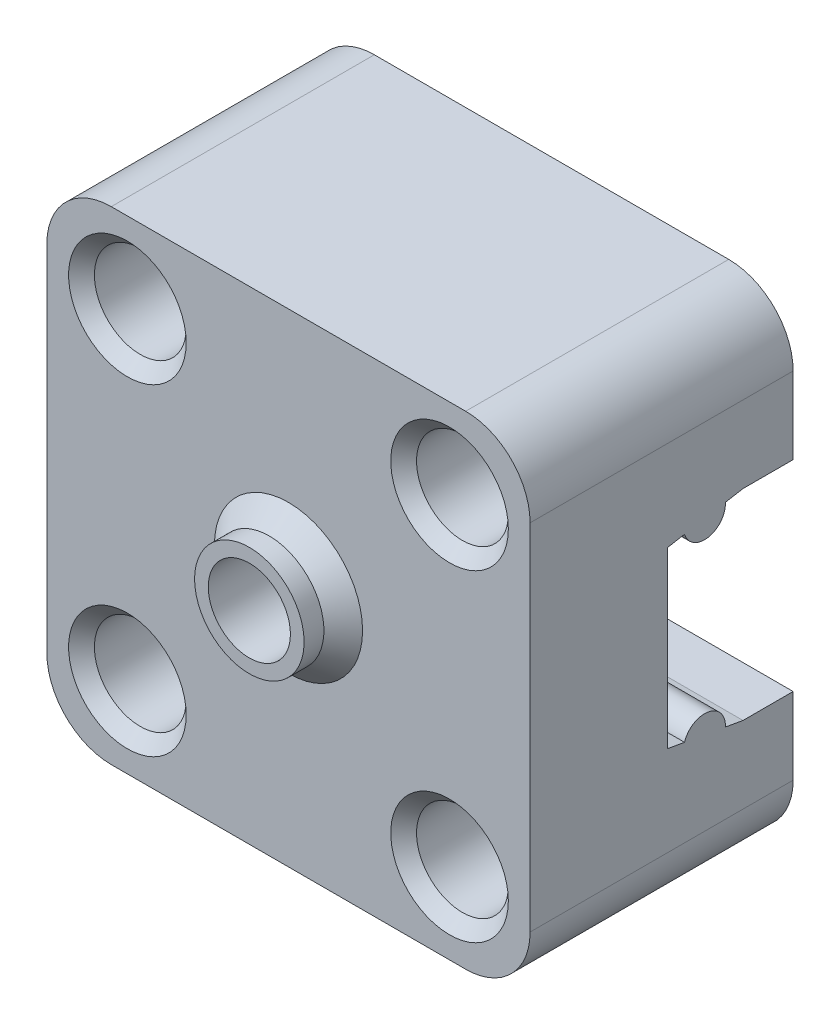
from build123d import *

# Parameters (mm, degrees)
SKETCH1_W                  = 30
SKETCH1_H                  = 30
SKETCH1_R                  = 1.6
SKETCH1_W_2                = 70
SKETCH1_H_2                = 12
BOSS_EXTRUDE1_DEPTH        = 6
SKETCH1_3_W                = 30
SKETCH1_3_H                = 30
SKETCH1_3_R                = 1.6
BOSS_EXTRUDE2_DEPTH        = 22.33
CUT_EXTRUDE1_DEPTH         = 78.612040947
SKETCH3_R                  = 2.55
CUT_EXTRUDE2_DEPTH         = 8
CUT_EXTRUDE3_DEPTH         = 4.5
SKETCH6_R                  = 5
CUT_EXTRUDE5_DEPTH         = 8.6
SKETCH7_R                  = 1.6
CUT_EXTRUDE6_DEPTH         = 101.740403513
SKETCH8_R                  = 2.85
CUT_EXTRUDE7_DEPTH         = 11
BOSS_EXTRUDE3_START        = 2.43
SKETCH9_R                  = 3.4
SKETCH9_R_2                = 2.55
BOSS_EXTRUDE3_DEPTH        = 2.43
CHAMFER1_SIZE              = 1.2
FILLET3_R                  = 4
CHAMFER2_SIZE              = 0.8
CUT_EXTRUDE8_DEPTH         = 3
CHAMFER3_SIZE              = 0.8
LPATTERN1_COUNT            = 3
LPATTERN1_PITCH            = 25
CHAMFER3_OF_LPATTERN1_SIZE = 0.8
SKETCH12_W                 = 103.210606925
SKETCH12_H                 = 33.832940417
CUT_EXTRUDE9_DEPTH         = 6


with BuildPart() as part:
    # Sketch1 → Boss-Extrude1 (new body)
    # profile 1 of 2: a face of its own
    with BuildSketch(Plane.XY):
        with Locations((10, 10)):
            Rectangle(SKETCH1_W, SKETCH1_H)
        with Locations((20, 0)):
            Circle(SKETCH1_R, mode=Mode.SUBTRACT)
        with Locations((20, 20)):
            Circle(SKETCH1_R, mode=Mode.SUBTRACT)
        with Locations((0, 20)):
            Circle(SKETCH1_R, mode=Mode.SUBTRACT)
        Circle(SKETCH1_R, mode=Mode.SUBTRACT)
    # profile 2 of 2: a face of its own
    with BuildSketch(Plane.XY):
        with Locations((60, 10)):
            Rectangle(SKETCH1_W_2, SKETCH1_H_2)
    extrude(amount=BOSS_EXTRUDE1_DEPTH)

    # Sketch1<3> → Boss-Extrude2 (add)
    with BuildSketch(Plane.XY):
        with Locations((10, 10)):
            Rectangle(SKETCH1_3_W, SKETCH1_3_H)
        with Locations((20, 0)):
            Circle(SKETCH1_3_R, mode=Mode.SUBTRACT)
        with Locations((20, 20)):
            Circle(SKETCH1_3_R, mode=Mode.SUBTRACT)
        with Locations((0, 20)):
            Circle(SKETCH1_3_R, mode=Mode.SUBTRACT)
        Circle(SKETCH1_3_R, mode=Mode.SUBTRACT)
    extrude(amount=BOSS_EXTRUDE2_DEPTH)

    # Sketch2 → Cut-Extrude1 (cut, through all)
    with BuildSketch(Plane(origin=(25, 0, 0), x_dir=(0, 0, -1), z_dir=(1, 0, 0))):
        with BuildLine():
            Line((-6.515476918, 16.231667643), (-9.112158418, 16.231667643))
            Line((-9.112158418, 16.231667643), (-10.20449761, 16.039058771))
            ThreePointArc((-10.20449761, 16.039058771), (-11.275650893, 14.693383456), (-12.742453793, 15.59154862))
            Line((-12.742453793, 15.59154862), (-13.786185118, 15.407510627))
            Line((-13.786185118, 15.407510627), (-13.786185118, 4.591753459))
            Line((-13.786185118, 4.591753459), (-12.742453793, 4.407715465))
            ThreePointArc((-12.742453793, 4.407715465), (-11.275650893, 5.305880629), (-10.20449761, 3.960205314))
            Line((-10.20449761, 3.960205314), (-9.112158418, 3.767596443))
            Line((-9.112158418, 3.767596443), (-6.515476918, 3.767596443))
            Line((-6.515476918, 3.767596443), (-5.902540869, 3.767596443))
            Line((-5.902540869, 3.767596443), (-5.902540869, 16.231667643))
            Line((-5.902540869, 16.231667643), (-6.515476918, 16.231667643))
        make_face()
    extrude(amount=-CUT_EXTRUDE1_DEPTH, mode=Mode.SUBTRACT)

    # Sketch3 → Cut-Extrude2 (cut)
    with BuildSketch(Plane.XY.offset(22.33)):
        with Locations((10, 10)):
            Circle(SKETCH3_R)
    extrude(amount=-CUT_EXTRUDE2_DEPTH, mode=Mode.SUBTRACT)

    # Sketch5 → Cut-Extrude3 (cut)
    with BuildSketch(Plane(origin=(0, 0, 13.786185118), x_dir=(-1, 0, 0), z_dir=(0, 0, -1))):
        Polygon((-5.32346282, 10), (-7.66173141, 14.05), (-12.33826859, 14.05), (-14.67653718, 10), (-12.33826859, 5.95), (-7.66173141, 5.95), align=None)
    extrude(amount=-CUT_EXTRUDE3_DEPTH, mode=Mode.SUBTRACT)

    # Sketch6 → Cut-Extrude5 (cut)
    with BuildSketch(Plane(origin=(0, 0, 0), x_dir=(-1, 0, 0), z_dir=(0, 0, -1))):
        with Locations((-10, 10)):
            Circle(SKETCH6_R)
    extrude(amount=-CUT_EXTRUDE5_DEPTH, mode=Mode.SUBTRACT)

    # Sketch7 → Cut-Extrude6 (cut, through all)
    with BuildSketch(Plane(origin=(0, 0, 0), x_dir=(-1, 0, 0), z_dir=(0, 0, -1))):
        with BuildLine():
            ThreePointArc((-90.1, 10), (-88.5, 8.4), (-86.9, 10))
            Line((-86.9, 10), (-90.1, 10))
        make_face()
        with BuildLine():
            Line((-90.1, 10), (-86.9, 10))
            ThreePointArc((-86.9, 10), (-88.5, 11.6), (-90.1, 10))
        make_face()
        with Locations((-63.5, 10)):
            Circle(SKETCH7_R)
        with Locations((-38.5, 10)):
            Circle(SKETCH7_R)
    extrude(amount=-CUT_EXTRUDE6_DEPTH, mode=Mode.SUBTRACT)

    # Sketch8 → Cut-Extrude7 (cut)
    with BuildSketch(Plane.XY.offset(22.33)):
        with Locations((20, 20)):
            Circle(SKETCH8_R)
        with Locations((20, 0)):
            Circle(SKETCH8_R)
        Circle(SKETCH8_R)
        with Locations((0, 20)):
            Circle(SKETCH8_R)
    extrude(amount=-CUT_EXTRUDE7_DEPTH, mode=Mode.SUBTRACT)

    # Sketch9 → Boss-Extrude3 (add)
    with BuildSketch(Plane.XY.offset(22.33).offset(BOSS_EXTRUDE3_START)):
        with Locations(Location((10, 10, 0), (0, 0, 180))):
            Circle(SKETCH9_R)
        with Locations((10, 10)):
            Circle(SKETCH9_R_2, mode=Mode.SUBTRACT)
    extrude(amount=-BOSS_EXTRUDE3_DEPTH)

    # Chamfer1
    chamfer1_edges = [part.edges().sort_by_distance(p)[0] for p in [
        (13.4, 10, 22.33),
    ]]
    chamfer(chamfer1_edges, length=CHAMFER1_SIZE)

    # Fillet3
    # the kernel refuses this fillet: 4 mm, written as the material it adds along each edge
    with BuildSketch(Plane(origin=(25, 4, 0), x_dir=(0, -1, 0), z_dir=(0, 0, 1))) as fillet3_piece_1:
        with BuildLine():
            CenterArc((FILLET3_R, FILLET3_R), FILLET3_R, 180, 90)
            Line((0, FILLET3_R), (0, 0))
            Line((0, 0), (FILLET3_R, 0))
        make_face()
    extrude(amount=5.902540869)
    with BuildSketch(Plane(origin=(25, 16, 0), x_dir=(0, 1, 0), z_dir=(0, 0, 1))) as fillet3_piece_2:
        with BuildLine():
            CenterArc((FILLET3_R, -FILLET3_R), FILLET3_R, 90, 90)
            Line((0, -FILLET3_R), (0, 0))
            Line((0, 0), (FILLET3_R, 0))
        make_face()
    extrude(amount=5.902540869)
    # the kernel refuses this fillet: 4 mm, written as the material it takes off along each edge
    with BuildSketch(Plane(origin=(-5, -5, 32.33), x_dir=(1, 0, 0), z_dir=(0, 0, -1)), Plane(origin=(-5, 25, 32.33), x_dir=(0, -1, 0), z_dir=(0, 0, -1)), Plane(origin=(25, 25, -10), x_dir=(0, -1, 0), z_dir=(0, 0, 1)), Plane(origin=(25, -5, -10), x_dir=(-1, 0, 0), z_dir=(0, 0, 1))) as fillet3_2_piece_1:
        with BuildLine():
            CenterArc((FILLET3_R, -FILLET3_R), FILLET3_R, 90, 90)
            Line((0, -FILLET3_R), (0, 0))
            Line((0, 0), (FILLET3_R, 0))
        make_face()
    extrude(amount=42.33, mode=Mode.SUBTRACT)
    with BuildSketch(Plane(origin=(95, 16, -10), x_dir=(-1, 0, 0), z_dir=(0, 0, 1))) as fillet3_2_piece_2:
        with BuildLine():
            CenterArc((FILLET3_R, FILLET3_R), FILLET3_R, 180, 90)
            Line((0, FILLET3_R), (0, 0))
            Line((0, 0), (FILLET3_R, 0))
        make_face()
    extrude(amount=26, mode=Mode.SUBTRACT)
    with BuildSketch(Plane(origin=(95, 4, -10), x_dir=(-1, 0, 0), z_dir=(0, 0, 1))) as fillet3_2_piece_3:
        with BuildLine():
            CenterArc((FILLET3_R, -FILLET3_R), FILLET3_R, 90, 90)
            Line((0, -FILLET3_R), (0, 0))
            Line((0, 0), (FILLET3_R, 0))
        make_face()
    extrude(amount=26, mode=Mode.SUBTRACT)

    # Chamfer2
    chamfer2_edges = [part.edges().sort_by_distance(p)[0] for p in [
        (-2.85, 20, 22.33),
        (-2.85, 0, 22.33),
        (17.15, 0, 22.33),
        (17.15, 20, 22.33),
    ]]
    chamfer(chamfer2_edges, length=CHAMFER2_SIZE)

    # Sketch10 → Cut-Extrude8 (cut)
    with BuildSketch(Plane(origin=(0, 0, 0), x_dir=(-1, 0, 0), z_dir=(0, 0, -1))):
        Polygon((-85.266838493, 10), (-86.883419246, 12.8), (-90.116580754, 12.8), (-91.733161507, 10), (-90.116580754, 7.2), (-86.883419246, 7.2), align=None)
    cut_extrude8 = extrude(amount=-CUT_EXTRUDE8_DEPTH, mode=Mode.SUBTRACT)

    # Chamfer3
    chamfer3_edges = [part.edges().sort_by_distance(p)[0] for p in [
        (86.075128869, 8.6, 0),
        (86.075128869, 11.4, 0),
        (88.5, 12.8, 0),
        (90.924871131, 11.4, 0),
        (90.924871131, 8.6, 0),
        (88.5, 7.2, 0),
    ]]
    chamfer(chamfer3_edges, length=CHAMFER3_SIZE)

    # LPattern1: Cut-Extrude8 ×3
    with Locations(*[(-i * LPATTERN1_PITCH, 0, 0) for i in range(1, LPATTERN1_COUNT)]):
        add(cut_extrude8, mode=Mode.SUBTRACT)

    # Chamfer3 of LPattern1
    chamfer3_of_lpattern1_edges = [part.edges().sort_by_distance(p)[0] for p in [
        (61.075128869, 8.6, 0),
        (61.075128869, 11.4, 0),
        (63.5, 12.8, 0),
        (65.924871131, 11.4, 0),
        (65.924871131, 8.6, 0),
        (63.5, 7.2, 0),
        (36.075128869, 8.6, 0),
        (36.075128869, 11.4, 0),
        (38.5, 12.8, 0),
        (40.924871131, 11.4, 0),
        (40.924871131, 8.6, 0),
        (38.5, 7.2, 0),
    ]]
    chamfer(chamfer3_of_lpattern1_edges, length=CHAMFER3_OF_LPATTERN1_SIZE)

    # Sketch12 → Cut-Extrude9 (cut)
    with BuildSketch(Plane(origin=(0, 0, 0), x_dir=(-1, 0, 0), z_dir=(0, 0, -1))):
        with Locations((-45.050346637, 9.848960088)):
            Rectangle(SKETCH12_W, SKETCH12_H)
    extrude(amount=-CUT_EXTRUDE9_DEPTH, mode=Mode.SUBTRACT)


solid = part.part
